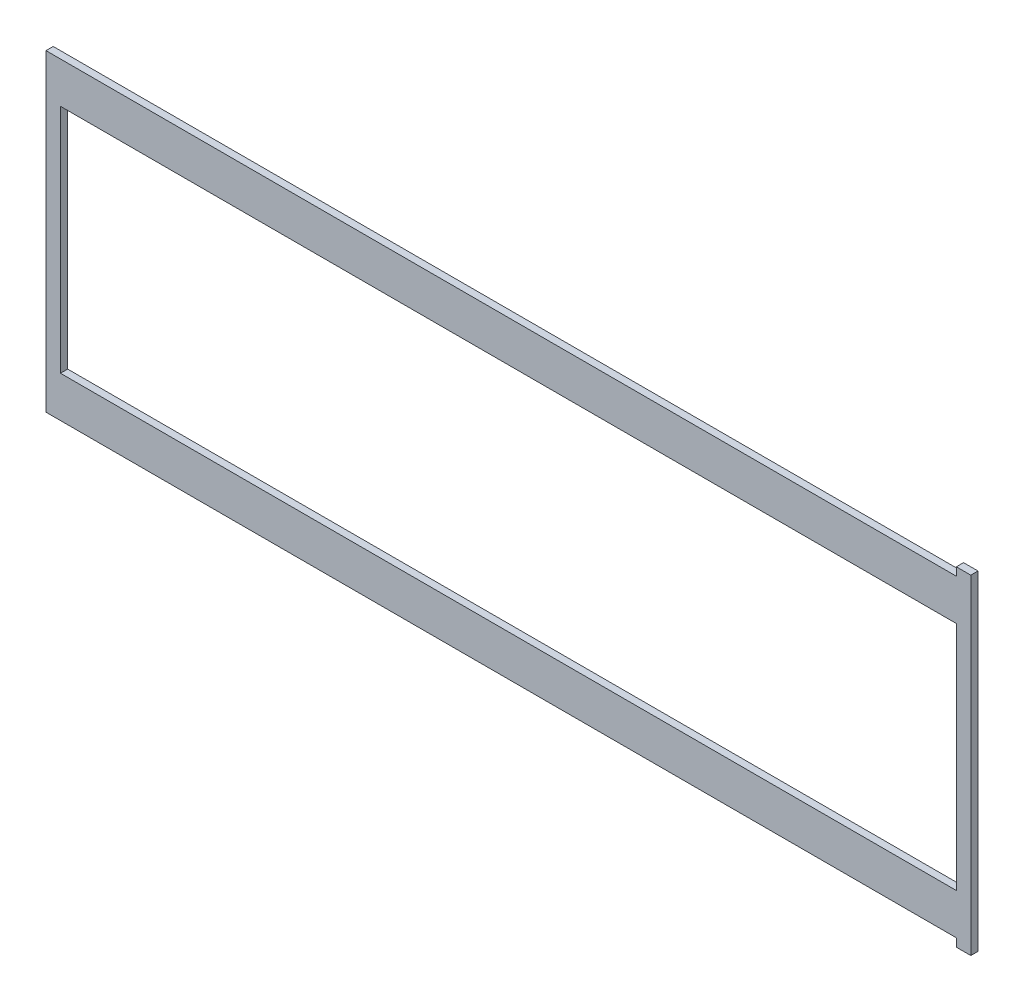
from build123d import *

# Parameters (mm, degrees)
SKETCH1_W           = 393.7
SKETCH1_H           = 101.6
BOSS_EXTRUDE1_DEPTH = 3.175


with BuildPart() as part:
    # Sketch1 → Boss-Extrude1 (new body)
    with BuildSketch(Plane.XY):
        Polygon((0, 137.6172), (0, 0), (400.05, 0), (400.05, -3.5814), (406.4, -3.5814), (406.4, 141.1986), (400.05, 141.1986), (400.05, 137.6172), align=None)
        with Locations((203.2, 68.8086)):
            Rectangle(SKETCH1_W, SKETCH1_H, mode=Mode.SUBTRACT)
    extrude(amount=BOSS_EXTRUDE1_DEPTH)


solid = part.part
